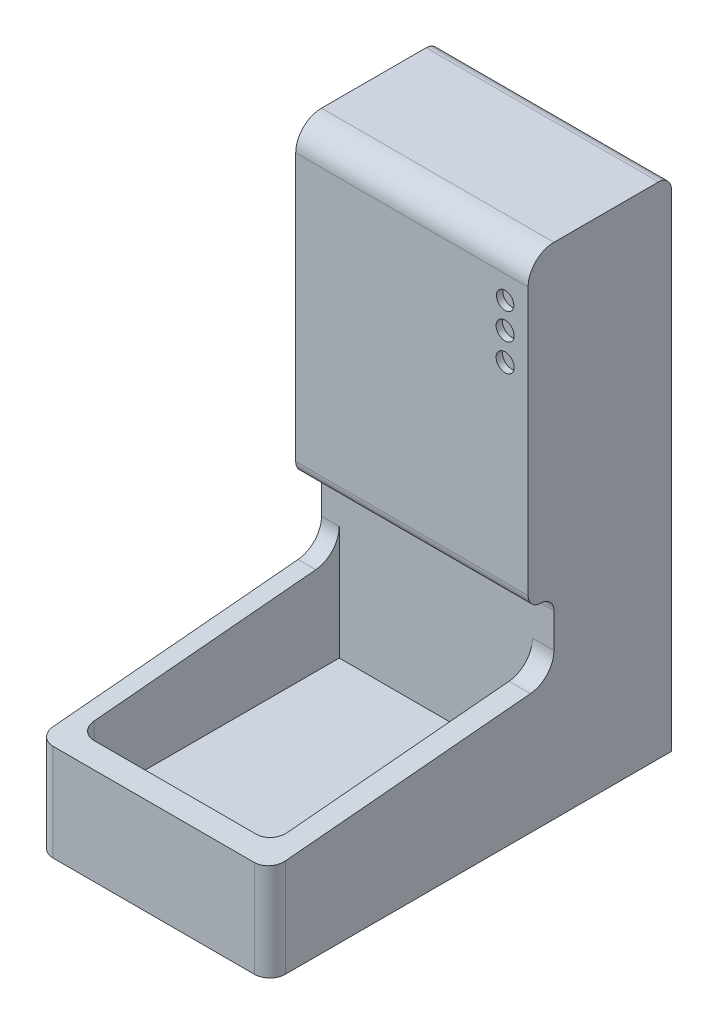
from build123d import *

# Parameters (mm, degrees)
BOSS_EXTRUDE4_DEPTH = 2286
FILLET6_R           = 508
FILLET8_R           = 254
FILLET13_R          = 508
FILLET17_R          = 254
SKETCH6_R           = 171.450155781
SKETCH6_R_2         = 178.044392542
CUT_EXTRUDE6_DEPTH  = 127
BOSS_EXTRUDE5_DEPTH = 4572
SKETCH8_W           = 3801.222009046
SKETCH8_H           = 5129.303596945
CUT_EXTRUDE7_DEPTH  = 2540
SKETCH9_W           = 3801.222009046
SKETCH9_H           = 5129.303596945
BOSS_EXTRUDE6_DEPTH = 635
FILLET20_R          = 304.8
FILLET22_R          = 508


with BuildPart() as part:
    # Sketch1 → Boss-Extrude4 (new, symmetric)
    with BuildSketch(Plane(origin=(0, 0, 0), x_dir=(0, 0, -1), z_dir=(1, 0, 0))):
        Polygon((-1409.7, -4914.9), (-6489.7, -4914.9), (-6489.7, -3009.9), (-901.7, -3009.9), (-901.7, -1104.9), (-1409.7, -1104.9), (-1409.7, 4914.9), (1409.7, 4914.9), (1409.7, -4914.9), align=None)
    extrude(amount=BOSS_EXTRUDE4_DEPTH, both=True)

    # Fillet6
    fillet6_edges = [part.edges().sort_by_distance(p)[0] for p in [
        (0, 4914.9, 1409.7),
    ]]
    fillet(fillet6_edges, radius=FILLET6_R)

    # Fillet8
    fillet8_edges = [part.edges().sort_by_distance(p)[0] for p in [
        (0, 4914.9, -1409.7),
        (0, -1104.9, 1409.7),
    ]]
    fillet(fillet8_edges, radius=FILLET8_R)

    # Fillet13
    fillet13_edges = [part.edges().sort_by_distance(p)[0] for p in [
        (0, -3009.9, 901.7),
    ]]
    fillet(fillet13_edges, radius=FILLET13_R)

    # Fillet17
    fillet17_edges = [part.edges().sort_by_distance(p)[0] for p in [
        (0, -1104.9, 901.7),
    ]]
    fillet(fillet17_edges, radius=FILLET17_R - 0.0001)  # a hair under: the kernel refuses the full size

    # Sketch6 → Cut-Extrude6 (cut)
    with BuildSketch(Plane.XY.offset(1409.7)):
        with Locations((1834.345031139, 3953.745263641)):
            Circle(SKETCH6_R)
        with Locations((1834.345031139, 3439.394796298)):
            Circle(SKETCH6_R_2)
        with Locations((1834.345031139, 2898.667381912)):
            Circle(SKETCH6_R_2)
    extrude(amount=-CUT_EXTRUDE6_DEPTH, mode=Mode.SUBTRACT)

    # Sketch7 → Boss-Extrude5 (add)
    with BuildSketch(Plane(origin=(2286, 0, 0), x_dir=(0, 0, -1), z_dir=(1, 0, 0))):
        Polygon((-6489.7, -3009.9), (-901.7, -2501.9), (-901.7, -3009.9), align=None)
    extrude(amount=-BOSS_EXTRUDE5_DEPTH)

    # Sketch8 → Cut-Extrude7 (cut)
    with BuildSketch(Plane.XZ.offset(4914.9)):
        with Locations((-36.640426205, 3466.351798472)):
            Rectangle(SKETCH8_W, SKETCH8_H)
    extrude(amount=-CUT_EXTRUDE7_DEPTH, mode=Mode.SUBTRACT)

    # Sketch9 → Boss-Extrude6 (add)
    with BuildSketch(Plane.XZ.offset(4914.9)):
        with Locations((-36.640426205, 3466.351798472)):
            Rectangle(SKETCH9_W, SKETCH9_H)
    extrude(amount=-BOSS_EXTRUDE6_DEPTH)

    # Fillet20
    fillet20_edges = [part.edges().sort_by_distance(p)[0] for p in [
        (-2286, -3962.4, 6489.7),
        (2286, -3962.4, 6489.7),
        (-1937.251430728, -3624.050163498, 6031.003596945),
        (1863.970578318, -3624.050163498, 6031.003596945),
    ]]
    fillet(fillet20_edges, radius=FILLET20_R)

    # Fillet22
    fillet22_edges = [part.edges().sort_by_distance(p)[0] for p in [
        (-2111.625715364, -2501.9, 901.7),
        (2074.985289159, -2501.9, 901.7),
    ]]
    fillet(fillet22_edges, radius=FILLET22_R)


solid = part.part
